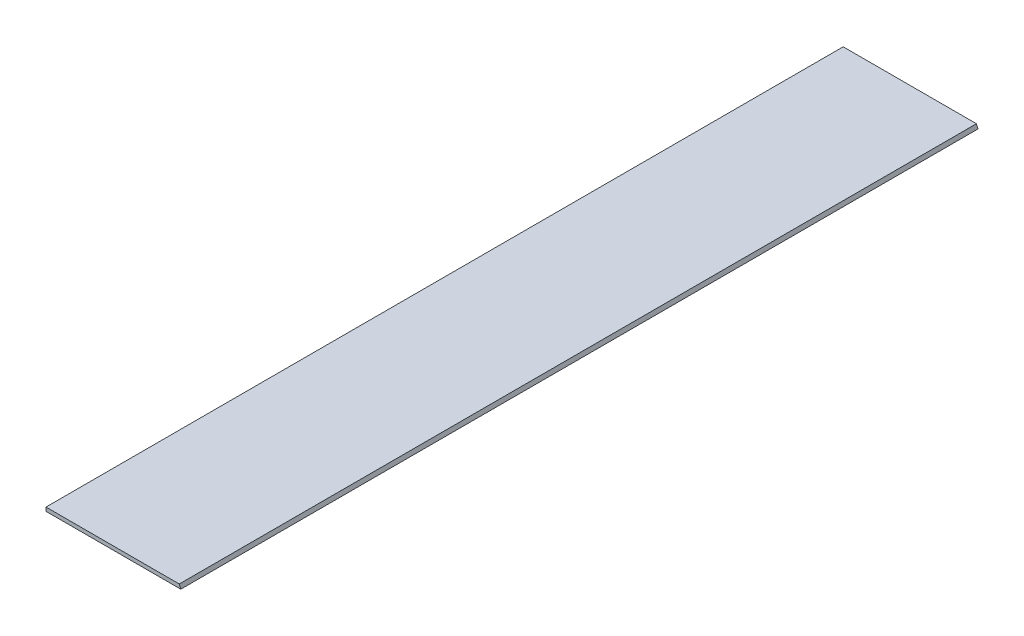
from build123d import *

# Parameters (mm, degrees)
BOSS_EXTRUDE1_DEPTH = 501.65


with BuildPart() as part:
    # Sketch1 → Boss-Extrude1 (new body)
    with BuildSketch(Plane.XY):
        Polygon((0, 0), (0, 2.3622), (83.857544723, 2.3622), (84.836, 0), align=None)
    extrude(amount=BOSS_EXTRUDE1_DEPTH)


solid = part.part
